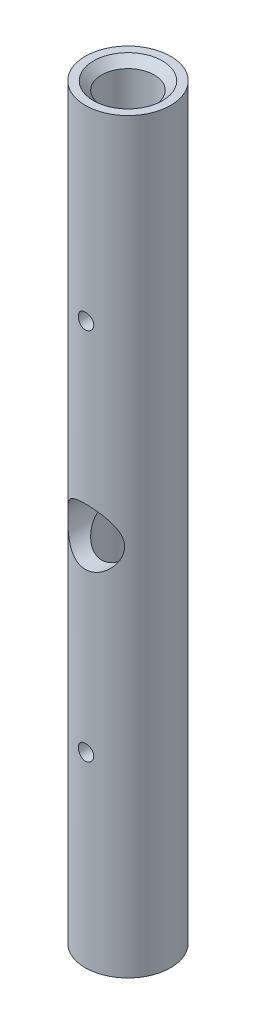
from build123d import *

# Parameters (mm, degrees)
SKETCH1_W                  = 5.25
SKETCH1_H                  = 92
HOLEWZD1_D                 = 7
F_6_5_6_5_DIAMETER_HOLE0_D = 6.5
HOLEWZD3_D                 = 1.9
HOLEWZD3_DEPTH             = 2.141945946
BOSS_EXTRUDE1_START        = -2
SKETCH7_R                  = 3.25
SKETCH7_R_2                = 2.25
BOSS_EXTRUDE1_DEPTH        = 2
BOSS_EXTRUDE2_START        = -2
SKETCH8_R                  = 3.25
SKETCH8_R_2                = 2.25
BOSS_EXTRUDE2_DEPTH        = 2
CHAMFER2_SIZE              = 1


with BuildPart() as part:
    # Sketch1 → Revolve1 (revolve)
    with BuildSketch(Plane(origin=(0, 0, 1.653301878), x_dir=(-1, 0, 0), z_dir=(0, 0, -1)), mode=Mode.PRIVATE) as revolve1_sk:
        with Locations((-2.625, 15.152992085)):
            Rectangle(SKETCH1_W, SKETCH1_H)
    revolve(revolve1_sk.sketch.rotate(Axis((0, -30.847007915, 1.653301878), (0, 1, 0)), 270), axis=Axis((0, -30.847007915, 1.653301878), (0, 1, 0)))

    # HoleWzd1 (through all)
    with Locations(Plane(origin=(0, 15.152992085, -3.596698122), x_dir=(-1, 0, 0), z_dir=(0, 0, -1))):
        with Locations((0, 0)):
            Hole(HOLEWZD1_D / 2)

    # Ø6.5 (6.5) Diameter Hole0 (through all)
    with Locations(Plane(origin=(0, 61.152992085, 0), x_dir=(1, 0, 0), z_dir=(0, 1, 0))):
        with Locations((0, -1.653301878)):
            Hole(F_6_5_6_5_DIAMETER_HOLE0_D / 2)

    # HoleWzd3
    with Locations(Plane(origin=(0, 0, 4.761355931), x_dir=(-1, 0, 0), z_dir=(0, 0, -1))):
        with Locations((0, 38.152992085), (0, -7.847007915)):
            Hole(HOLEWZD3_D / 2, depth=HOLEWZD3_DEPTH)

    # Sketch7 → Boss-Extrude1 (add)
    with BuildSketch(Plane(origin=(0, 35.152992085, 0), x_dir=(1, 0, 0), z_dir=(0, 1, 0)).offset(BOSS_EXTRUDE1_START)):
        with Locations(Location((0, -1.653301878, 0), (0, 0, 270))):
            Circle(SKETCH7_R)
        with Locations(Location((0, -1.653301878, 0), (0, 0, 270))):
            Circle(SKETCH7_R_2, mode=Mode.SUBTRACT)
    boss_extrude1 = extrude(amount=BOSS_EXTRUDE1_DEPTH)

    # Sketch8 → Boss-Extrude2 (add)
    with BuildSketch(Plane(origin=(0, 25.152992085, 0), x_dir=(1, 0, 0), z_dir=(0, 1, 0)).offset(BOSS_EXTRUDE2_START)):
        with Locations(Location((0, -1.653301878, 0), (0, 0, 270))):
            Circle(SKETCH8_R)
        with Locations(Location((0, -1.653301878, 0), (0, 0, 270))):
            Circle(SKETCH8_R_2, mode=Mode.SUBTRACT)
    boss_extrude2 = extrude(amount=BOSS_EXTRUDE2_DEPTH)

    # Chamfer2
    chamfer2_edges = [part.edges().sort_by_distance(p)[0] for p in [
        (3.25, -30.847007915, 1.653301878),
        (3.25, 61.152992085, 1.653301878),
    ]]
    chamfer(chamfer2_edges, length=CHAMFER2_SIZE)

    # Mirror1: Boss-Extrude1, Boss-Extrude2 across plane
    add(boss_extrude1.mirror(Plane.ZX.offset(15.152992085)))
    add(boss_extrude2.mirror(Plane.ZX.offset(15.152992085)))


with BuildPart() as part_1:
    # Move Body 1: read off the stored shape, not the designer's step
    # Move Body 1: moved
    add(part.part.moved(Location((0, -15.1529921, -1.6533019))))


solid = part_1.part
